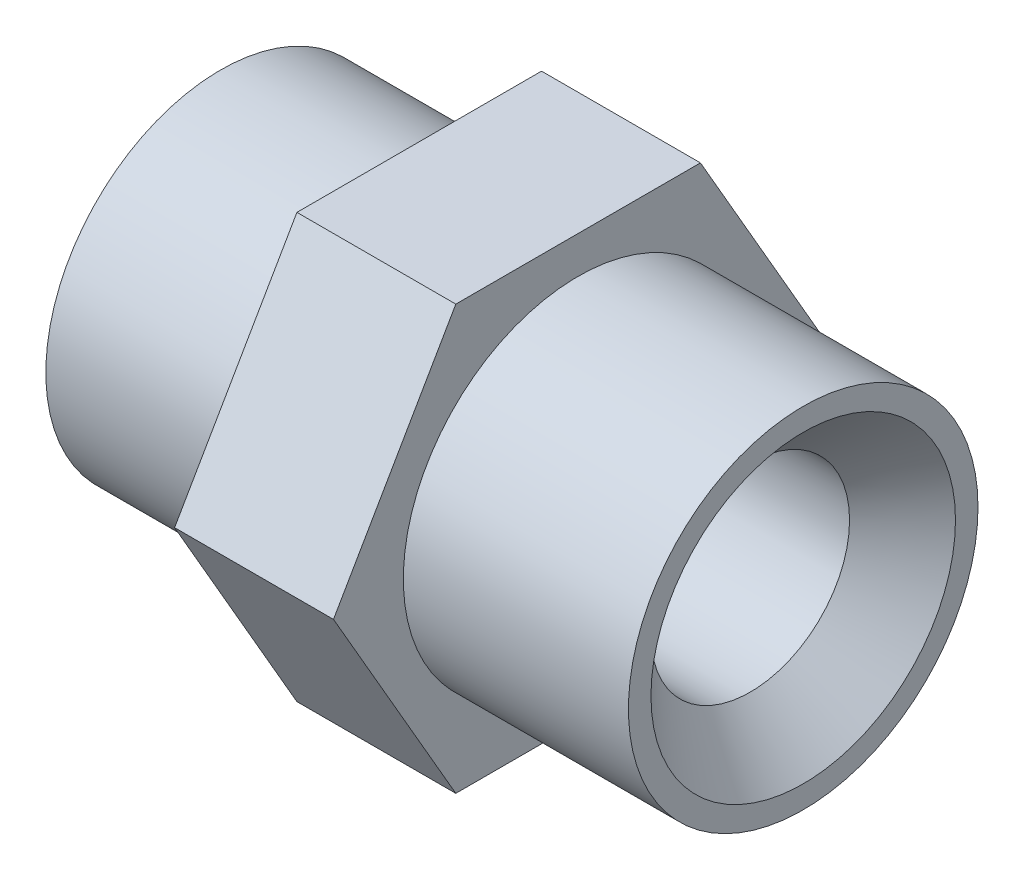
from build123d import *

# Parameters (mm, degrees)
SZKIC1_R                    = 13.2
SZKIC1_R_2                  = 7.5
DODANIE_WYCI_GNI_CIE1_DEPTH = 44
DODANIE_WYCI_GNI_CIE2_DEPTH = 12
SFAZOWANIE1_SIZE            = 4
SZKIC8_R                    = 7.5
WYTNIJ_WYCI_GNI_CIE1_DEPTH  = 12
SFAZOWANIE2_SIZE            = 4


with BuildPart() as part:
    # Szkic1 → Dodanie-wyciągnięcie1 (new body)
    with BuildSketch(Plane(origin=(0, 0, 0), x_dir=(0, 0, -1), z_dir=(1, 0, 0))):
        Circle(SZKIC1_R)
        Circle(SZKIC1_R_2, mode=Mode.SUBTRACT)
    extrude(amount=DODANIE_WYCI_GNI_CIE1_DEPTH)

    # Szkic6 → Dodanie-wyciągnięcie2 (add)
    with BuildSketch(Plane(origin=(15, 0, 0), x_dir=(0, 0, -1), z_dir=(1, 0, 0))):
        Polygon((18.475208614, 0), (9.237604307, 16), (-9.237604307, 16), (-18.475208614, 0), (-9.237604307, -16), (9.237604307, -16), align=None)
    extrude(amount=DODANIE_WYCI_GNI_CIE2_DEPTH)

    # Sfazowanie1
    sfazowanie1_edges = [part.edges().sort_by_distance(p)[0] for p in [
        (44, 0, 7.5),
    ]]
    chamfer(sfazowanie1_edges, length=SFAZOWANIE1_SIZE)

    # Szkic8 → Wytnij-wyciągnięcie1 (cut)
    with BuildSketch(Plane.ZY.offset(-15)):
        Circle(SZKIC8_R)
    extrude(amount=-WYTNIJ_WYCI_GNI_CIE1_DEPTH, mode=Mode.SUBTRACT)

    # Sfazowanie2
    sfazowanie2_edges = [part.edges().sort_by_distance(p)[0] for p in [
        (0, 0, 7.5),
    ]]
    chamfer(sfazowanie2_edges, length=SFAZOWANIE2_SIZE)


solid = part.part
